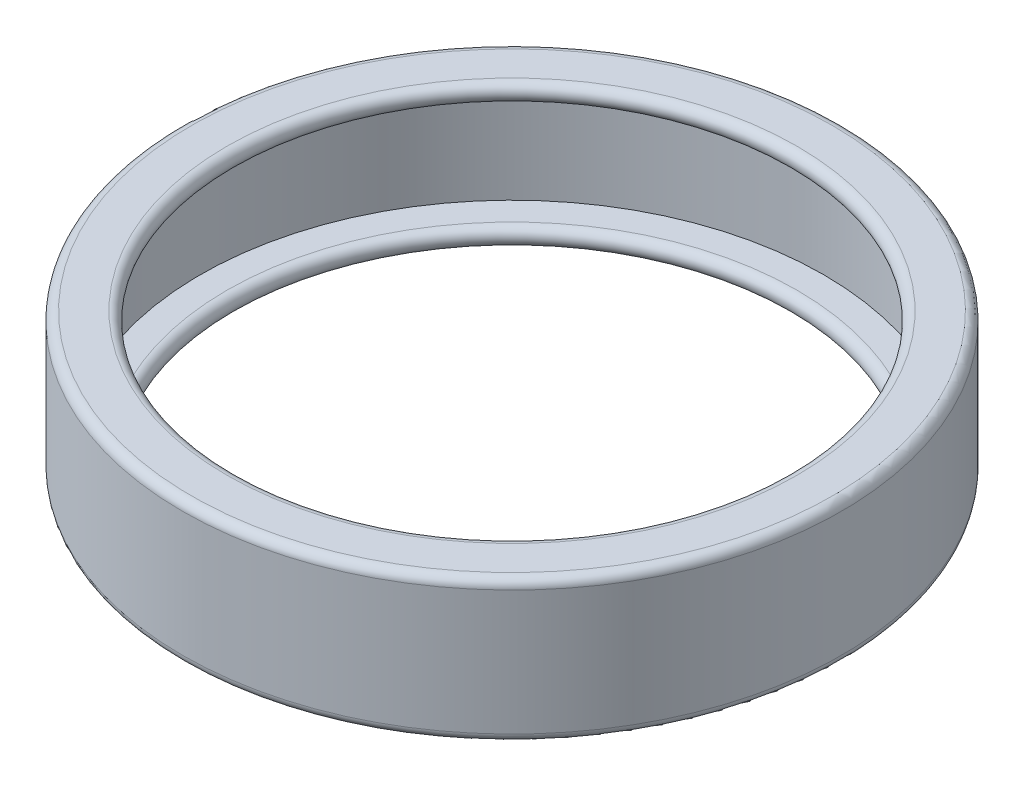
from build123d import *

# Parameters (mm, degrees)
FILLET1_R = 0.5
FILLET2_R = 0.5
FILLET3_R = 0.5


with BuildPart() as part:
    # Sketch1 → Revolve1 (revolve)
    with BuildSketch(Plane.YZ, mode=Mode.PRIVATE) as revolve1_sk:
        Polygon((-4, 15.5), (-4, 18.5), (4, 18.5), (4, 15.5), (3, 15.5), (3, 17.5), (-3, 17.5), (-3, 15.5), align=None)
    revolve(revolve1_sk.sketch.rotate(Axis((0, -15.446930484, 0), (0, 1, 0)), 180), axis=Axis((0, -15.446930484, 0), (0, 1, 0)))

    # Fillet1
    fillet1_edges = [part.edges().sort_by_distance(p)[0] for p in [
        (0, 4, 18.5),
        (0, -4, 18.5),
    ]]
    fillet(fillet1_edges, radius=FILLET1_R)

    # Fillet2
    fillet2_edges = [part.edges().sort_by_distance(p)[0] for p in [
        (0, 3, 15.5),
        (0, 4, 15.5),
    ]]
    fillet(fillet2_edges, radius=FILLET2_R - 0.0001)  # a hair under: the kernel refuses the full size

    # Fillet3
    fillet3_edges = [part.edges().sort_by_distance(p)[0] for p in [
        (0, -4, 15.5),
        (0, -3, 15.5),
    ]]
    fillet(fillet3_edges, radius=FILLET3_R - 0.0001)  # a hair under: the kernel refuses the full size


solid = part.part
